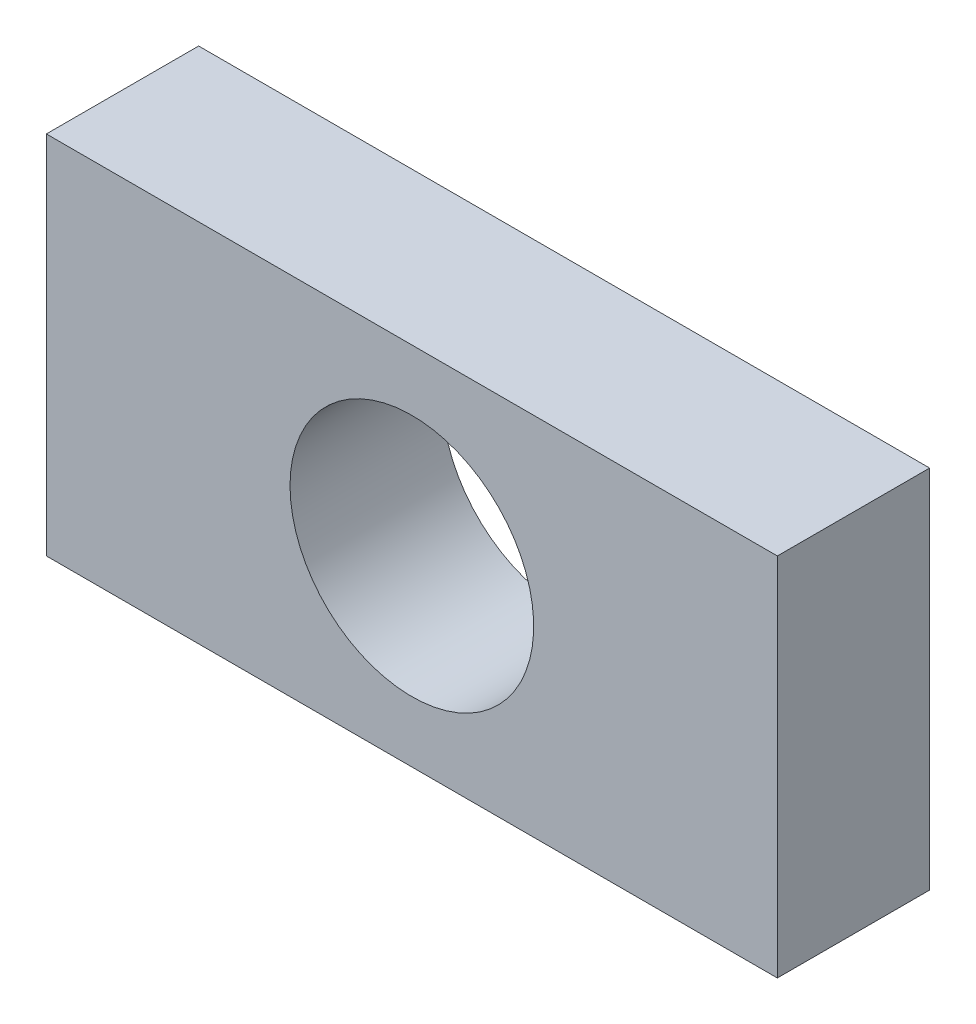
from build123d import *

# Parameters (mm, degrees)
SKETCH1_W           = 152.4
SKETCH1_H           = 76.2
BOSS_EXTRUDE1_DEPTH = 31.75
SKETCH2_R           = 25.4
CUT_EXTRUDE1_DEPTH  = 174.321269612


with BuildPart() as part:
    # Sketch1 → Boss-Extrude1 (new body)
    with BuildSketch(Plane.XY):
        with Locations((76.2, 38.1)):
            Rectangle(SKETCH1_W, SKETCH1_H)
    extrude(amount=BOSS_EXTRUDE1_DEPTH)

    # Sketch2 → Cut-Extrude1 (cut, through all)
    with BuildSketch(Plane(origin=(0, 0, 0), x_dir=(-1, 0, 0), z_dir=(0, 0, -1))):
        with Locations((-76.2, 38.1)):
            Circle(SKETCH2_R)
    extrude(amount=-CUT_EXTRUDE1_DEPTH, mode=Mode.SUBTRACT)


solid = part.part
